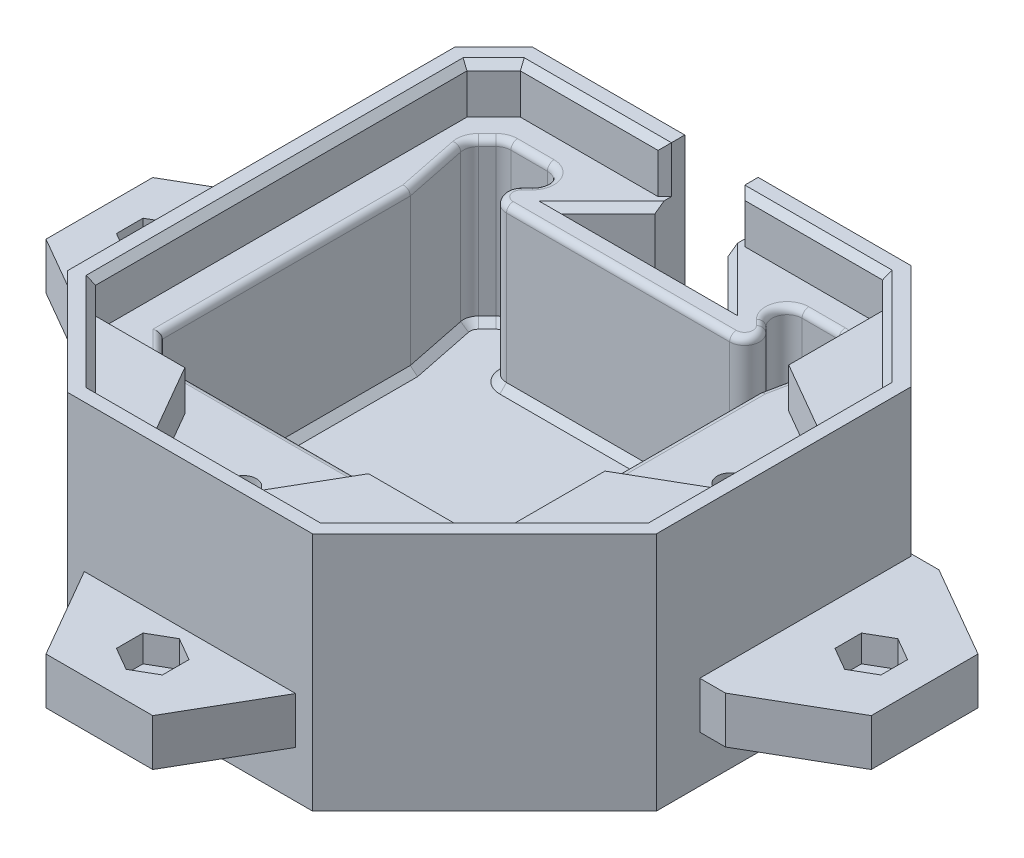
from build123d import *

# Parameters (mm, degrees)
BOSS_EXTRUDE1_DEPTH      = 6
BOSS_EXTRUDE1_DEPTH_BACK = 29
CUT_EXTRUDE1_DEPTH       = 6
CUT_EXTRUDE2_DEPTH       = 69.327816198
CUT_EXTRUDE2_DEPTH_BACK  = 69.327816198
SKETCH5_R                = 1.95
CUT_EXTRUDE3_DEPTH       = 12
SKETCH6_W                = 62.3
SKETCH6_H                = 63.674798272
CUT_EXTRUDE4_DEPTH       = 6
CUT_EXTRUDE5_DEPTH       = 24
BOSS_EXTRUDE2_DEPTH      = 36
CHAMFER1_SIZE            = 1
FILLET2_R                = 2.25
FILLET1_R                = 1
CHAMFER3_SIZE            = 1
CHAMFER5_SIZE            = 1
BOSS_EXTRUDE3_START      = -7
SKETCH12_R               = 2
BOSS_EXTRUDE3_DEPTH      = 7
CUT_EXTRUDE8_START       = -14
CUT_EXTRUDE8_DEPTH       = 4


with BuildPart() as part:
    # Sketch2 → Boss-Extrude1 (new, two sides: drawn at the far end of the back side and taken through both)
    with BuildSketch(Plane(origin=(0, 0, 0), x_dir=(1, 0, 0), z_dir=(0, 1, 0)).offset(-BOSS_EXTRUDE1_DEPTH_BACK)):
        Polygon((17.15, -41.837399136), (-17.15, -41.837399136), (-31.15, -27.837399136), (-31.15, 27.837399136), (-27.15, 31.837399136), (27.15, 31.837399136), (41.15, 17.837399136), (41.15, -17.837399136), align=None)
    extrude(amount=BOSS_EXTRUDE1_DEPTH + BOSS_EXTRUDE1_DEPTH_BACK)

    # Sketch3 → Cut-Extrude1 (cut)
    with BuildSketch(Plane(origin=(0, 6, 0), x_dir=(1, 0, 0), z_dir=(0, 1, 0))):
        Polygon((-8, -41.837399136), (-13.773502692, -31.837399136), (13.773502692, -31.837399136), (8, -41.837399136), align=None)
        Polygon((41.15, -8), (41.15, 8), (31.15, 13.773502692), (31.15, -13.773502692), align=None)
    extrude(amount=-CUT_EXTRUDE1_DEPTH, mode=Mode.SUBTRACT)

    # Sketch4 → Cut-Extrude2 (cut, two sides: drawn at the far end of the back side and taken through both)
    with BuildSketch(Plane(origin=(0, 6, 0), x_dir=(1, 0, 0), z_dir=(0, 1, 0)).offset(-CUT_EXTRUDE2_DEPTH_BACK)):
        Polygon((-5.5, 31.837399136), (5.5, 31.837399136), (5.5, 30.337399136), (12.5, 23.337399136), (-12.5, 23.337399136), (-5.5, 30.337399136), align=None)
    extrude(amount=CUT_EXTRUDE2_DEPTH + CUT_EXTRUDE2_DEPTH_BACK, mode=Mode.SUBTRACT)

    # Sketch5 → Cut-Extrude3 (cut)
    with BuildSketch(Plane(origin=(0, 0, 0), x_dir=(1, 0, 0), z_dir=(0, 1, 0))):
        with Locations(Location((36.15, 0, 0), (0, 0, 270))):
            Circle(SKETCH5_R)
        with Locations(Location((0, -36.837399136, 0), (0, 0, 270))):
            Circle(SKETCH5_R)
    extrude(amount=-CUT_EXTRUDE3_DEPTH, mode=Mode.SUBTRACT)

    # Sketch6 → Cut-Extrude4 (cut)
    with BuildSketch(Plane(origin=(0, 6, 0), x_dir=(1, 0, 0), z_dir=(0, 1, 0))):
        Rectangle(SKETCH6_W, SKETCH6_H)
    extrude(amount=-CUT_EXTRUDE4_DEPTH, mode=Mode.SUBTRACT)

    # Sketch7 → Cut-Extrude5 (cut)
    with BuildSketch(Plane(origin=(0, 0, 0), x_dir=(1, 0, 0), z_dir=(0, 1, 0))):
        Polygon((-26.15, 14.337399136), (-26.15, -22.837399136), (-22.15, -26.837399136), (22.15, -26.837399136), (26.15, -22.837399136), (26.15, 14.337399136), (28.321572875, 25.008972011), (25.493145751, 27.837399136), (13.656854249, 27.837399136), (22.156854249, 19.337399136), (-22.156854249, 19.337399136), (-13.656854249, 27.837399136), (-25.493145751, 27.837399136), (-28.321572875, 25.008972011), align=None)
    extrude(amount=-CUT_EXTRUDE5_DEPTH, mode=Mode.SUBTRACT)

    # Sketch8 → Boss-Extrude2 (add)
    with BuildSketch(Plane.XZ.offset(29)):
        Polygon((28.392640687, -34.837399136), (44.15, -19.080039823), (44.15, 19.080039823), (18.392640687, 44.837399136), (-18.392640687, 44.837399136), (-34.15, 29.080039823), (-34.15, -29.080039823), (-28.392640687, -34.837399136), (-5.5, -34.837399136), (-5.5, -31.837399136), (-27.15, -31.837399136), (-31.15, -27.837399136), (-31.15, 27.837399136), (-17.15, 41.837399136), (17.15, 41.837399136), (41.15, 17.837399136), (41.15, -17.837399136), (27.15, -31.837399136), (5.5, -31.837399136), (5.5, -34.837399136), align=None)
    extrude(amount=-BOSS_EXTRUDE2_DEPTH)

    # Chamfer1
    chamfer1_edges = [part.edges().sort_by_distance(p)[0] for p in [
        (-16.325, 7, -31.837399136),
        (16.325, 7, -31.837399136),
        (34.15, 7, -24.837399136),
        (41.15, 7, 0),
        (29.15, 7, 29.837399136),
        (0, 7, 41.837399136),
        (-24.15, 7, 34.837399136),
        (-31.15, 7, 0),
        (-29.15, 7, -29.837399136),
    ]]
    chamfer(chamfer1_edges, length=CHAMFER1_SIZE - 0.0001)  # a hair under: the kernel refuses the full size

    # Fillet2
    fillet2_edges = [part.edges().sort_by_distance(p)[0] for p in [
        (-28.321572875, -12, -25.008972011),
        (-25.493145751, -12, -27.837399136),
        (-13.656854249, -12, -27.837399136),
        (-22.156854249, -12, -19.337399136),
        (22.156854249, -12, -19.337399136),
        (13.656854249, -12, -27.837399136),
        (25.493145751, -12, -27.837399136),
        (28.321572875, -12, -25.008972011),
    ]]
    fillet(fillet2_edges, radius=FILLET2_R)

    # Fillet1
    fillet1_edges = [part.edges().sort_by_distance(p)[0] for p in [
        (-26.15, 0, 4.25),
        (-24.15, 0, 24.837399136),
        (0, 0, 26.837399136),
        (24.15, 0, 24.837399136),
        (26.15, 0, 4.25),
        (27.115244011, 0, -19.080814346),
        (26.809410007, 0, -26.521134879),
        (21.825, 0, -27.837399136),
        (-27.115244011, 0, -19.080814346),
        (-26.809410007, 0, -26.521134879),
        (-21.825, 0, -27.837399136),
        (17.906854249, 0, -23.587399136),
        (-17.906854249, 0, -23.587399136),
        (0, 0, -19.337399136),
        (-18.803602682, 0, -20.726361413),
        (18.803602682, 0, -20.726361413),
        (28.030221986, 0, -24.921291305),
        (25.422202958, 0, -27.666128084),
        (-28.030221986, 0, -24.921291305),
        (-25.422202958, 0, -27.666128084),
        (17.010105817, 0, -26.448436858),
        (-17.010105817, 0, -26.448436858),
    ]]
    fillet(fillet1_edges, radius=FILLET1_R)

    # Chamfer3
    chamfer3_edges = [part.edges().sort_by_distance(p)[0] for p in [
        (-27.115244011, -24, -19.080814346),
        (26.15, -24, 4.25),
        (24.15, -24, 24.837399136),
        (0, -24, 26.837399136),
        (-24.15, -24, 24.837399136),
        (-26.15, -24, 4.25),
        (26.809410007, -24, -26.521134879),
        (27.115244011, -24, -19.080814346),
        (21.825, -24, -27.837399136),
        (17.906854249, -24, -23.587399136),
        (0, -24, -19.337399136),
        (-17.906854249, -24, -23.587399136),
        (-21.825, -24, -27.837399136),
        (-26.809410007, -24, -26.521134879),
        (-17.010105817, -24, -26.448436858),
        (17.010105817, -24, -26.448436858),
        (-25.422202958, -24, -27.666128084),
        (-28.030221986, -24, -24.921291305),
        (25.422202958, -24, -27.666128084),
        (28.030221986, -24, -24.921291305),
        (18.803602682, -24, -20.726361413),
        (-18.803602682, -24, -20.726361413),
    ]]
    chamfer(chamfer3_edges, length=CHAMFER3_SIZE)

    # Chamfer5
    chamfer5_edges = [part.edges().sort_by_distance(p)[0] for p in [
        (5.5, 3.00005, -31.837399136),
        (-5.5, 3.00005, -31.837399136),
        (9, 0, -26.837399136),
        (0, 0, -23.337399136),
        (-9, 0, -26.837399136),
    ]]
    chamfer(chamfer5_edges, length=CHAMFER5_SIZE)

    # Sketch12 → Boss-Extrude3 (add)
    # profile 1 of 3: a face of its own
    with BuildSketch(Plane.XZ.offset(29).offset(BOSS_EXTRUDE3_START)):
        Polygon((-48, 12.562600864), (-34.143593539, 12.562600864), (-34.143593539, 4.562600864), (-34.143593539, -11.437399136), (-34.143593539, -19.437399136), (-48, -19.437399136), (-61.856406461, -11.437399136), (-61.856406461, 4.562600864), align=None)
        with Locations(Location((-53.856406461, -3.437399136, 0), (0, 0, 270))):
            Circle(SKETCH12_R, mode=Mode.SUBTRACT)
    # profile 2 of 3: a face of its own
    with BuildSketch(Plane.XZ.offset(29).offset(BOSS_EXTRUDE3_START)):
        Polygon((16, 44.562600864), (16, 30.706194404), (8, 30.706194404), (-8, 30.706194404), (-16, 30.706194404), (-16, 44.562600864), (-8, 58.419007325), (8, 58.419007325), align=None)
        with Locations(Location((0, 50.419007325, 0), (0, 0, 270))):
            Circle(SKETCH12_R, mode=Mode.SUBTRACT)
    # profile 3 of 3: a face of its own
    with BuildSketch(Plane.XZ.offset(29).offset(BOSS_EXTRUDE3_START)):
        Polygon((48, -19.437399136), (34.143593539, -19.437399136), (34.143593539, -11.437399136), (34.143593539, 4.562600864), (34.143593539, 12.562600864), (48, 12.562600864), (61.856406461, 4.562600864), (61.856406461, -11.437399136), align=None)
        with Locations(Location((53.856406461, -3.437399136, 0), (0, 0, 270))):
            Circle(SKETCH12_R, mode=Mode.SUBTRACT)
    extrude(amount=-BOSS_EXTRUDE3_DEPTH)

    # Sketch15 → Cut-Extrude8 (cut)
    with BuildSketch(Plane.XZ.offset(29).offset(CUT_EXTRUDE8_START)):
        Polygon((-50.406406461, -1.445540707), (-53.856406461, 0.546317722), (-57.306406461, -1.445540707), (-57.306406461, -5.429257564), (-53.856406461, -7.421115993), (-50.406406461, -5.429257564), align=None)
        Polygon((0, 54.402724182), (-3.45, 52.410865754), (-3.45, 48.427148896), (0, 46.435290468), (3.45, 48.427148896), (3.45, 52.410865754), align=None)
        Polygon((53.856406461, 0.546317722), (50.406406461, -1.445540707), (50.406406461, -5.429257564), (53.856406461, -7.421115993), (57.306406461, -5.429257564), (57.306406461, -1.445540707), align=None)
    extrude(amount=CUT_EXTRUDE8_DEPTH, mode=Mode.SUBTRACT)


solid = part.part
